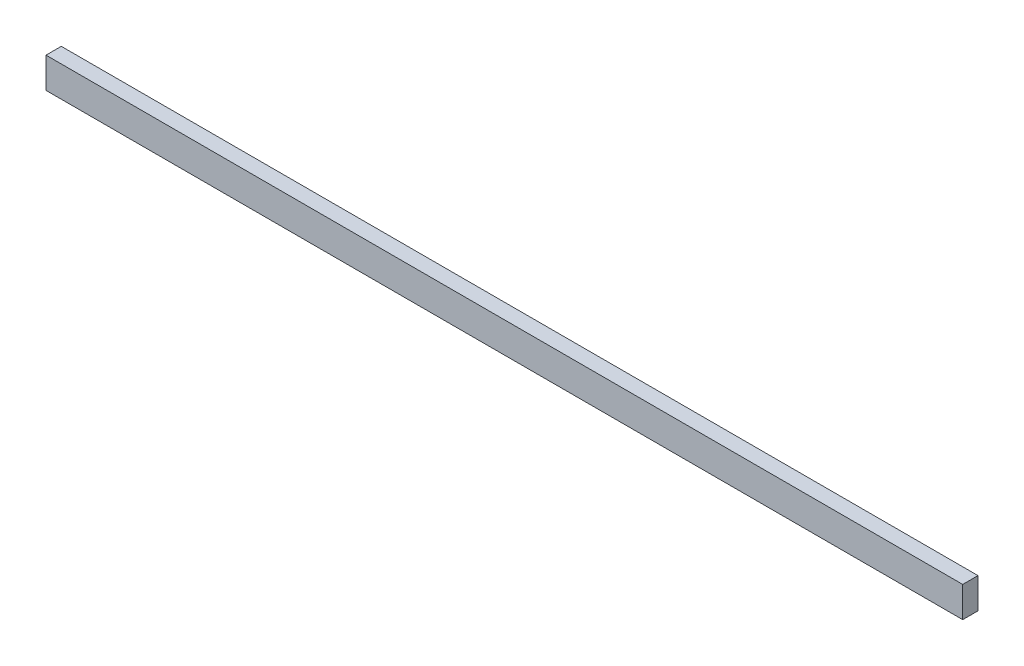
from build123d import *

# Parameters (mm, degrees)
SKETCH1_W          = 152.4
SKETCH1_H          = 5.08
BASE_FLANGE1_DEPTH = 2.54


# Sheet-metal steps are written as plain solids
with BuildPart() as part:
    # Sketch1 → Base-Flange1 (new body)
    with BuildSketch(Plane.XY):
        with Locations((76.2, 2.54)):
            Rectangle(SKETCH1_W, SKETCH1_H)
    extrude(amount=BASE_FLANGE1_DEPTH)


solid = part.part
